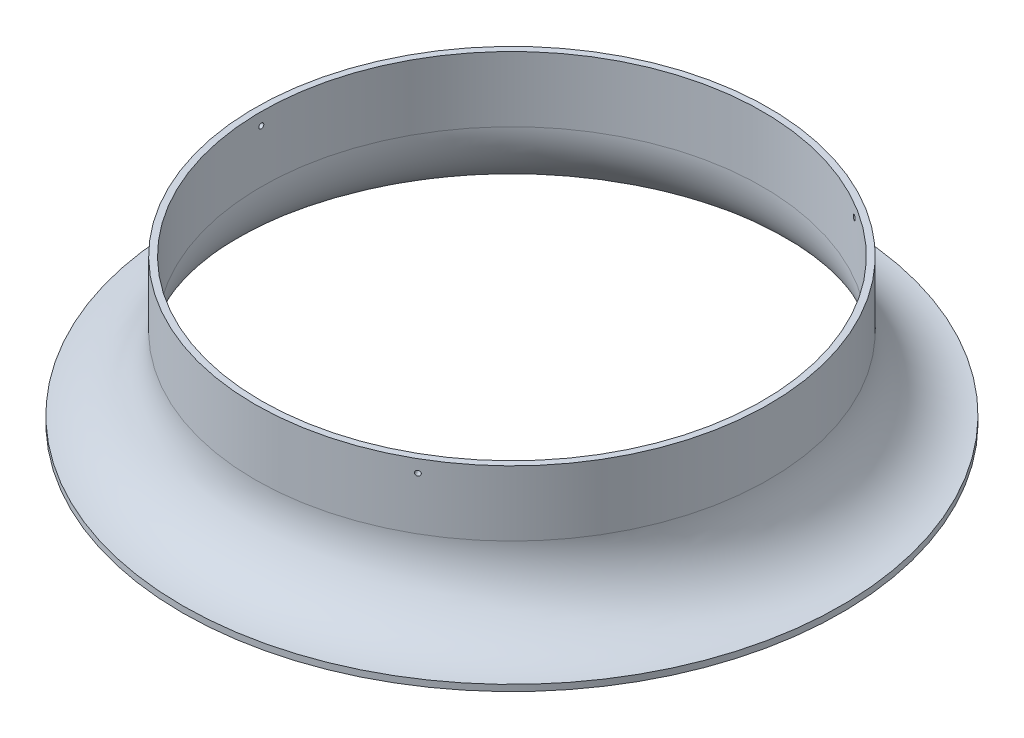
from build123d import *

# Parameters (mm, degrees)
LOFT_THIN1_START       = 39
LOFT_THIN1_OUTLINE_R   = 205
LOFT_THIN1_OUTLINE_R_2 = 200
LOFT_THIN1_DEPTH       = 52
SKETCH6_R              = 2
CUT_EXTRUDE1_DEPTH     = 10
CIRPATTERN1_COUNT      = 3


# Read off the part's stored shape, not the designer's step: Loft-Thin1
with BuildPart() as part:
    # Loft-Thin1 outline → Loft-Thin1 (new body)
    with BuildSketch(Plane(origin=(0, 0, 0), x_dir=(1, 0, 0), z_dir=(0, 1, 0)).offset(LOFT_THIN1_START)):
        Circle(LOFT_THIN1_OUTLINE_R)
        Circle(LOFT_THIN1_OUTLINE_R_2, mode=Mode.SUBTRACT)
    extrude(amount=LOFT_THIN1_DEPTH)

    # Sketch5 → Revolve-Thin2 (revolve)
    with BuildSketch(Plane.XY, mode=Mode.PRIVATE) as revolve_thin2_sk:
        with BuildLine():
            ThreePointArc((205, 39), (221.987806691, -2.012193309), (263, -19))
            Line((263, -19), (263, -24))
            ThreePointArc((263, -24), (218.452272785, -5.547727215), (200, 39))
            Line((200, 39), (205, 39))
        make_face()
    revolve(revolve_thin2_sk.sketch.rotate(Axis((0, 91, 0), (0, -1, 0)), 90), axis=Axis((0, 91, 0), (0, -1, 0)))

    # Sketch6 → Cut-Extrude1 (cut)
    with BuildSketch(Plane.ZY.offset(205)):
        with Locations((0, 81)):
            Circle(SKETCH6_R)
    cut_extrude1 = extrude(amount=-CUT_EXTRUDE1_DEPTH, mode=Mode.SUBTRACT)

    # CirPattern1: Cut-Extrude1 ×3 about axis
    cirpattern1_axis = Axis((0, 91, 0), (0, 1, 0))
    for i in range(1, CIRPATTERN1_COUNT):
        add(cut_extrude1.rotate(cirpattern1_axis, i * 360 / CIRPATTERN1_COUNT), mode=Mode.SUBTRACT)


solid = part.part
